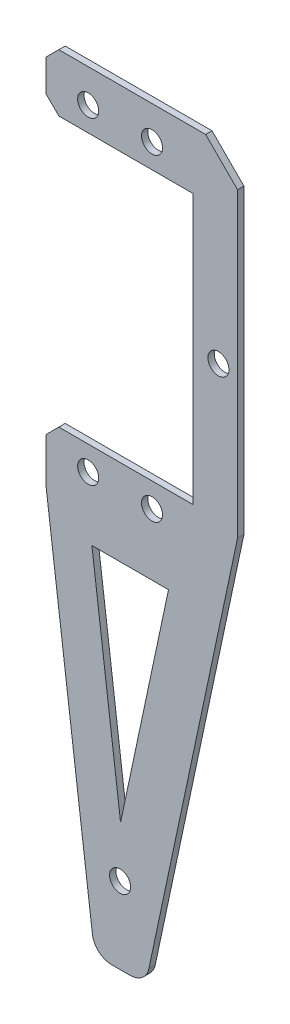
from build123d import *

# Parameters (mm, degrees)
SM_BASE_FLANGE_1_DEPTH  = 1
HOLE_WIZARD_3_3_3_3_1_D = 3.3
CHAMFER_2_SIZE          = 5
FILLET_1_R              = 3
CHAMFER_3_SIZE          = 2


# Sheet-metal steps are written as plain solids
with BuildPart() as part:
    # Sketch 1 → 基体-法兰1 (new body)
    with BuildSketch(Plane.XY):
        Polygon((-23, 0), (0, 0), (0, 42.2), (-23, 42.2), (-23, 51.2), (7, 51.2), (7, -1.053326424), (-7.4, -68.8), (-15.4, -68.8), (-23, -9), align=None)
        Polygon((-15.817797263, -13.469186385), (-3.817797263, -13.469186385), (-11.327593526, -48.8), align=None, mode=Mode.SUBTRACT)
    extrude(amount=-SM_BASE_FLANGE_1_DEPTH)

    # Ø3.3 (3.3) 直径孔1 (through all)
    with Locations(Plane.XY):
        with Locations((-6.4, 46), (-16.4, 46), (-16.4, -3.8), (-6.4, -3.8), (4, 21.1), (-11.4, -56.8)):
            Hole(HOLE_WIZARD_3_3_3_3_1_D / 2)

    # 倒角2
    chamfer_2_edges = [part.edges().sort_by_distance(p)[0] for p in [
        (7, 51.2, -0.5),
    ]]
    chamfer(chamfer_2_edges, length=CHAMFER_2_SIZE)

    # 圆角1
    fillet_1_edges = [part.edges().sort_by_distance(p)[0] for p in [
        (-7.4, -68.8, -0.5),
        (-15.4, -68.8, -0.5),
    ]]
    fillet(fillet_1_edges, radius=FILLET_1_R)

    # 倒角3
    chamfer_3_edges = [part.edges().sort_by_distance(p)[0] for p in [
        (-23, 0, -0.5),
        (-23, 42.2, -0.5),
        (-23, 51.2, -0.5),
    ]]
    chamfer(chamfer_3_edges, length=CHAMFER_3_SIZE)


solid = part.part
